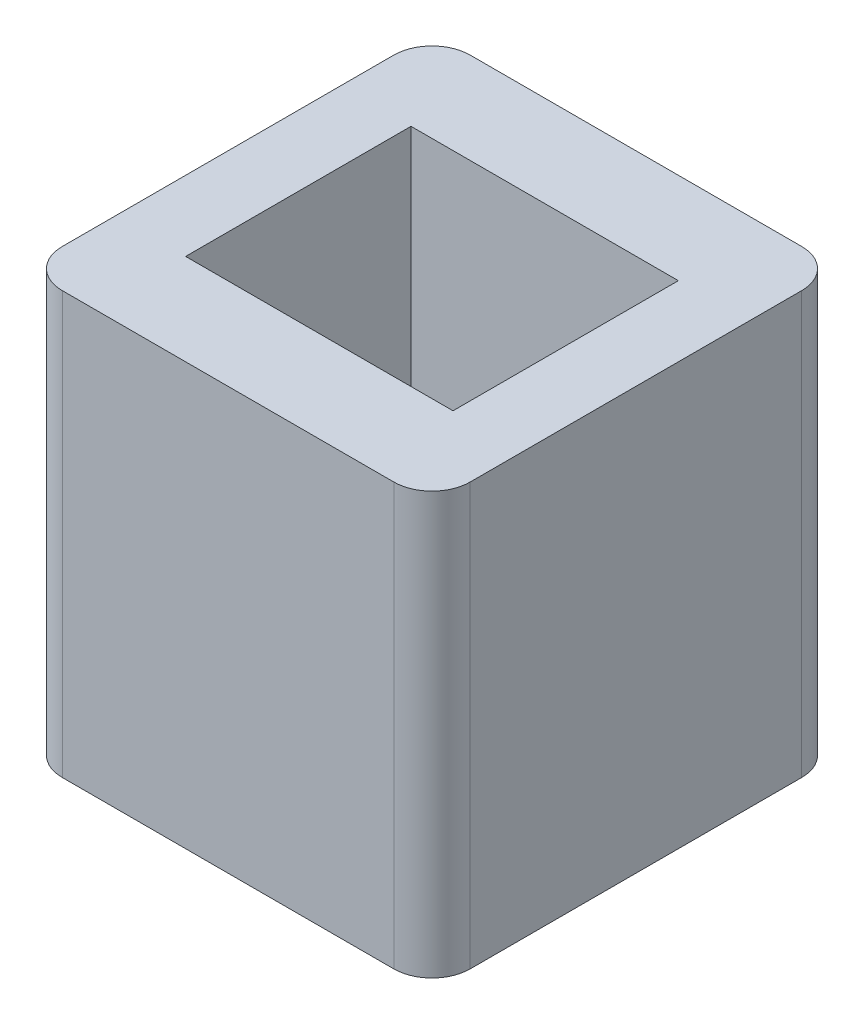
from build123d import *

# Parameters (mm, degrees)
SKETCH1_W           = 35
SKETCH1_H           = 29.5
BOSS_EXTRUDE1_DEPTH = 27.6


with BuildPart() as part:
    # Sketch1 → Boss-Extrude1 (new, symmetric)
    with BuildSketch(Plane(origin=(0, 0, 0), x_dir=(1, 0, 0), z_dir=(0, 1, 0))):
        with BuildLine():
            Line((-21.7, 26.7), (21.7, 26.7))
            ThreePointArc((21.7, 26.7), (25.235533906, 25.235533906), (26.7, 21.7))
            Line((26.7, 21.7), (26.7, -21.7))
            ThreePointArc((26.7, -21.7), (25.235533906, -25.235533906), (21.7, -26.7))
            Line((21.7, -26.7), (-21.7, -26.7))
            ThreePointArc((-21.7, -26.7), (-25.235533906, -25.235533906), (-26.7, -21.7))
            Line((-26.7, -21.7), (-26.7, 21.7))
            ThreePointArc((-26.7, 21.7), (-25.235533906, 25.235533906), (-21.7, 26.7))
        make_face()
        Rectangle(SKETCH1_W, SKETCH1_H, mode=Mode.SUBTRACT)
    extrude(amount=BOSS_EXTRUDE1_DEPTH, both=True)


solid = part.part
